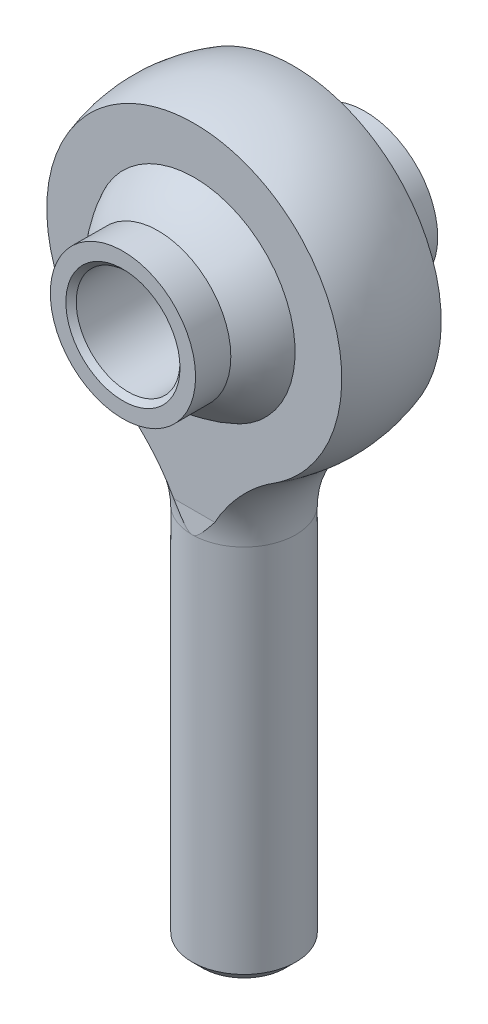
from build123d import *
from OCP.BRepAlgoAPI import BRepAlgoAPI_Cut
from OCP.TopTools import TopTools_ListOfShape

# Parameters (mm, degrees)
CUT_EXTRUDE1_DEPTH      = 41.348741461
CUT_EXTRUDE1_DEPTH_BACK = 41.348741461
CUT_EXTRUDE4_DEPTH      = 40.119878359
CUT_EXTRUDE4_DEPTH_BACK = 40.119878359
SKETCH10_R              = 4.7625
EXTRUDE1_DEPTH          = 11.1125
EXTRUDE1_DEPTH_BACK     = 11.1125
SKETCH12_R              = 6.6675
SKETCH12_R_2            = 4.7625
CHAMFER1_SIZE           = 0.47625


with BuildPart() as part:
    # Sketch13 → Revolve4 (revolve)
    with BuildSketch(Plane.XY, mode=Mode.PRIVATE) as revolve4_sk:
        Polygon((3.809238, -34.925), (4.7625, -33.971738), (4.7625, 0), (0, 0), (0, -34.925), align=None)
    revolve(revolve4_sk.sketch.rotate(Axis((0, 0, 0), (0, -1, 0)), 180), axis=Axis((0, 0, 0), (0, -1, 0)))

    # Sketch4 → Revolve2 (revolve)
    with BuildSketch(Plane.XY):
        with BuildLine():
            Line((0, 8.73125), (0, 0))
            Line((0, 0), (4.7625, 0))
            ThreePointArc((4.7625, 0), (5.768081006, 4.259709497), (8.5725, 7.62))
            ThreePointArc((8.5725, 7.62), (13.554312621, 23.568104207), (0, 33.3375))
            Line((0, 33.3375), (0, 29.36875))
            ThreePointArc((0, 29.36875), (10.31875, 19.05), (0, 8.73125))
        make_face()
    revolve(axis=Axis((0, 33.3375, 0), (0, 1, 0)))


with BuildPart() as cut_extrude1_tool:
    # Sketch5 → Cut-Extrude1 (new, two sides: drawn at the far end of the back side and taken through both)
    with BuildSketch(Plane(origin=(0, 0, 0), x_dir=(0, 0, -1), z_dir=(1, 0, 0)).offset(-CUT_EXTRUDE1_DEPTH_BACK)):
        Polygon((4.5640625, 33.3375), (14.2875, 33.3375), (14.2875, 0), (4.7625, 0), (4.5640625, 1.825625), align=None)
        Polygon((-4.5640625, 33.3375), (-4.5640625, 1.825625), (-4.7625, 0), (-14.2875, 0), (-14.2875, 33.3375), align=None)
    extrude(amount=CUT_EXTRUDE1_DEPTH + CUT_EXTRUDE1_DEPTH_BACK)


with BuildPart() as part_1:
    add(part.part)

    # Cut-Extrude1: cut by cut_extrude1_tool, with a tolerance
    cut_extrude1_stock = TopTools_ListOfShape()
    cut_extrude1_stock.Append(part_1.part.wrapped)
    cut_extrude1_tools = TopTools_ListOfShape()
    cut_extrude1_tools.Append(cut_extrude1_tool.part.wrapped)
    cut_extrude1_cut = BRepAlgoAPI_Cut()
    cut_extrude1_cut.SetArguments(cut_extrude1_stock)
    cut_extrude1_cut.SetTools(cut_extrude1_tools)
    cut_extrude1_cut.SetFuzzyValue(0.00001)
    cut_extrude1_cut.Build()
    add(Compound.cast(cut_extrude1_cut.Shape()).solids(), mode=Mode.REPLACE)


with BuildPart() as body_2:
    # Sketch7 → Revolve3 (revolve)
    with BuildSketch(Plane.XY):
        with BuildLine():
            Line((0, 29.36875), (0, 8.73125))
            ThreePointArc((0, 8.73125), (10.31875, 19.05), (0, 29.36875))
        make_face()
    revolve(axis=Axis((0, 0, 0), (0, 1, 0)))

    # Sketch10 → Cut-Extrude4 (cut, two sides: drawn at the far end of the back side and taken through both)
    with BuildSketch(Plane.XY.offset(-CUT_EXTRUDE4_DEPTH_BACK)):
        with Locations(Location((0, 19.05, 0), (0, 0, 180))):
            Circle(SKETCH10_R)
    extrude(amount=CUT_EXTRUDE4_DEPTH + CUT_EXTRUDE4_DEPTH_BACK, mode=Mode.SUBTRACT)

    # Sketch12 → Extrude1 (add, two sides: drawn at the far end of the back side and taken through both)
    with BuildSketch(Plane.XY.offset(-EXTRUDE1_DEPTH_BACK)):
        with Locations((0, 19.05)):
            Circle(SKETCH12_R)
        with Locations((0, 19.05)):
            Circle(SKETCH12_R_2, mode=Mode.SUBTRACT)
    extrude(amount=EXTRUDE1_DEPTH + EXTRUDE1_DEPTH_BACK)

    # Chamfer1
    chamfer1_edges = [body_2.edges().sort_by_distance(p)[0] for p in [
        (-4.7625, 19.05, 11.1125),
        (-4.7625, 19.05, -11.1125),
    ]]
    chamfer(chamfer1_edges, length=CHAMFER1_SIZE)


solid = Compound([part_1.part, body_2.part])
